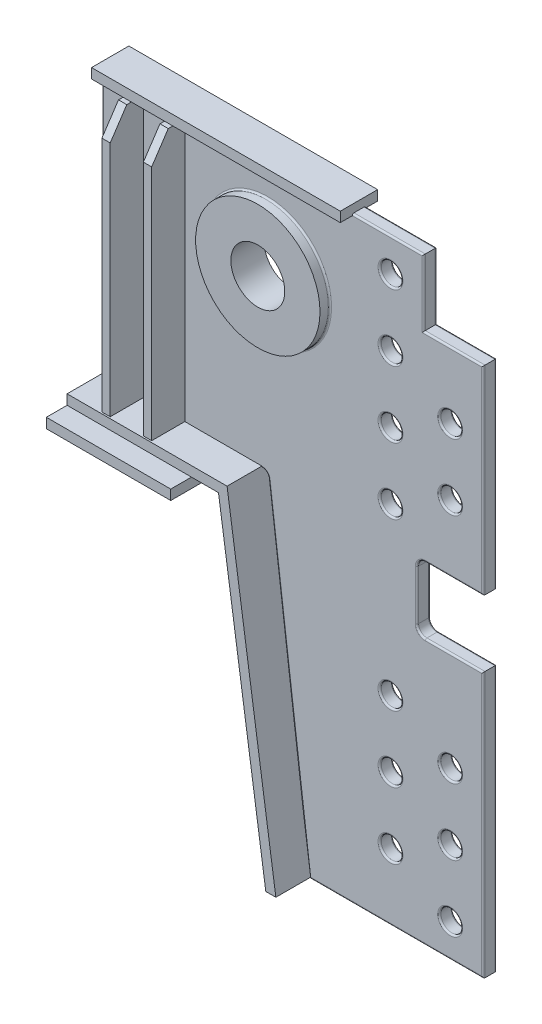
from build123d import *

# Parameters (mm, degrees)
SKETCH_1_R           = 13
SKETCH_1_R_2         = 37.5
EXTRUDE_1401_DEPTH   = 16
EXTRUDE_1_DEPTH      = 12
EXTRUDE_1_DEPTH_BACK = 28
SKETCH_2_R           = 75
SKETCH_2_R_2         = 32.5
FILLET_1_R           = 2
FILLET_2_R           = 2
EXTRUDE_2_DEPTH      = 40
EXTRUDE_2_DEPTH_BACK = 56
SKETCH_3_W           = 10
SKETCH_3_H           = 316
CUT_EXTRUDE_1_DEPTH  = 836.425640018
CUT_EXTRUDE_2_DEPTH  = 836.425640018
EXTRUDE_5_DEPTH      = 42
EXTRUDE_5_DEPTH_BACK = 58
EXTRUDE_6_DEPTH      = 14.5
EXTRUDE_6_DEPTH_BACK = 30.5
SKETCH_7_W           = 300
SKETCH_7_H           = 12
SKETCH_8_W           = 150
SKETCH_8_H           = 150
EXTRUDE_7_DEPTH      = 12


with BuildPart() as part:
    # 草图1 → Extrude 1401 (new body)
    with BuildSketch(Plane.XY):
        with BuildLine():
            Line((0, -320), (-70, -320))
            ThreePointArc((-70, -320), (-77.071067812, -322.928932188), (-80, -330))
            Line((-80, -330), (-80, -390))
            ThreePointArc((-80, -390), (-77.071067812, -397.071067812), (-70, -400))
            Line((-70, -400), (0, -400))
            Line((0, -400), (0, -720))
            Line((0, -720), (-210, -720))
            Line((-210, -720), (-259.124034735, -327.007722123))
            ThreePointArc((-259.124034735, -327.007722123), (-261.767837242, -322.002574593), (-267.062257748, -320))
            Line((-267.062257748, -320), (-460, -320))
            Line((-460, -320), (-460, 0))
            Line((-460, 0), (-72, 0))
            Line((-72, 0), (-72, -80))
            Line((-72, -80), (0, -80))
            Line((0, -80), (0, -320))
        make_face()
        with Locations((-112, -40)):
            Circle(SKETCH_1_R, mode=Mode.SUBTRACT)
        with Locations((-112, -120)):
            Circle(SKETCH_1_R, mode=Mode.SUBTRACT)
        with Locations((-112, -200)):
            Circle(SKETCH_1_R, mode=Mode.SUBTRACT)
        with Locations((-112, -280)):
            Circle(SKETCH_1_R, mode=Mode.SUBTRACT)
        with Locations((-40, -160)):
            Circle(SKETCH_1_R, mode=Mode.SUBTRACT)
        with Locations((-40, -240)):
            Circle(SKETCH_1_R, mode=Mode.SUBTRACT)
        with Locations((-40, -680)):
            Circle(SKETCH_1_R, mode=Mode.SUBTRACT)
        with Locations((-40, -600)):
            Circle(SKETCH_1_R, mode=Mode.SUBTRACT)
        with Locations((-40, -520)):
            Circle(SKETCH_1_R, mode=Mode.SUBTRACT)
        with Locations((-112, -640)):
            Circle(SKETCH_1_R, mode=Mode.SUBTRACT)
        with Locations((-112, -560)):
            Circle(SKETCH_1_R, mode=Mode.SUBTRACT)
        with Locations((-112, -480)):
            Circle(SKETCH_1_R, mode=Mode.SUBTRACT)
        with Locations((-260, -110)):
            Circle(SKETCH_1_R_2, mode=Mode.SUBTRACT)
    extrude(amount=EXTRUDE_1401_DEPTH)

    # 草图2 → 凸台-拉伸1 (add, two sides: drawn at the far end of the back side and taken through both)
    with BuildSketch(Plane.XY.offset(16).offset(-EXTRUDE_1_DEPTH_BACK)):
        with Locations((-260, -110)):
            Circle(SKETCH_2_R)
        with Locations((-260, -110)):
            Circle(SKETCH_2_R_2, mode=Mode.SUBTRACT)
    extrude(amount=EXTRUDE_1_DEPTH + EXTRUDE_1_DEPTH_BACK)

    # 圆角1
    fillet_1_edges = [part.edges().sort_by_distance(p)[0] for p in [
        (-335, -110, 16),
        (-125, -560, 16),
        (-53, -600, 16),
        (-53, -240, 16),
        (-35, -320, 16),
        (-77.071067812, -322.928932188, 16),
        (-80, -360, 16),
        (-77.071067812, -397.071067812, 16),
        (-35, -400, 16),
        (0, -560, 16),
        (-105, -720, 16),
        (-234.562017367, -523.503861062, 16),
        (-261.767837242, -322.002574593, 16),
        (-363.531128874, -320, 16),
        (-460, -160, 16),
        (-266, 0, 16),
        (-53, -680, 16),
        (-53, -520, 16),
        (-125, -480, 16),
        (-125, -640, 16),
        (-125, -280, 16),
        (-125, -120, 16),
        (-72, -40, 16),
        (-36, -80, 16),
        (0, -200, 16),
        (-125, -40, 16),
        (-125, -200, 16),
        (-53, -160, 16),
    ]]
    fillet(fillet_1_edges, radius=FILLET_1_R)

    # 圆角2
    fillet_2_edges = [part.edges().sort_by_distance(p)[0] for p in [
        (-335, -110, 0),
        (-125, -560, 0),
        (-53, -600, 0),
        (-53, -240, 0),
        (-266, 0, 0),
        (-460, -160, 0),
        (-363.531128874, -320, 0),
        (-261.767837242, -322.002574593, 0),
        (-234.562017367, -523.503861062, 0),
        (-105, -720, 0),
        (0, -560, 0),
        (-35, -400, 0),
        (-77.071067812, -397.071067812, 0),
        (-80, -360, 0),
        (-77.071067812, -322.928932188, 0),
        (-35, -320, 0),
        (-53, -680, 0),
        (-53, -520, 0),
        (-125, -480, 0),
        (-125, -640, 0),
        (-125, -280, 0),
        (-125, -120, 0),
        (0, -200, 0),
        (-36, -80, 0),
        (-72, -40, 0),
        (-125, -40, 0),
        (-125, -200, 0),
        (-53, -160, 0),
    ]]
    fillet(fillet_2_edges, radius=FILLET_2_R)

    # 草图3 → 凸台-拉伸2 (add, two sides: drawn at the far end of the back side and taken through both)
    with BuildSketch(Plane.XY.offset(16).offset(-EXTRUDE_2_DEPTH_BACK)):
        with Locations((-415, -160)):
            Rectangle(SKETCH_3_W, SKETCH_3_H)
        with Locations((-365, -160)):
            Rectangle(SKETCH_3_W, SKETCH_3_H)
    extrude(amount=EXTRUDE_2_DEPTH + EXTRUDE_2_DEPTH_BACK)

    # 草图4 → 切除-拉伸1 (cut, through all)
    with BuildSketch(Plane.ZY.offset(420)):
        Polygon((-20, -2), (-45.5, -32), (-45.5, -2), align=None)
    extrude(amount=-CUT_EXTRUDE_1_DEPTH, mode=Mode.SUBTRACT)

    # 草图5 → 切除-拉伸2 (cut, through all)
    with BuildSketch(Plane.ZY.offset(420)):
        Polygon((36, -2), (56, -32), (56, -2), align=None)
    extrude(amount=-CUT_EXTRUDE_2_DEPTH, mode=Mode.SUBTRACT)

    # 草图6 → 凸台-拉伸5 (add, two sides: drawn at the far end of the back side and taken through both)
    with BuildSketch(Plane.XY.offset(16).offset(-EXTRUDE_5_DEPTH_BACK)):
        Polygon((-267.062257748, -318), (-460, -318), (-460, -330), (-277.426505546, -330), (-220.363518026, -718), (-208.234435563, -718), align=None)
    extrude(amount=EXTRUDE_5_DEPTH + EXTRUDE_5_DEPTH_BACK)

    # 草图7 → 凸台-拉伸6 (add, two sides: drawn at the far end of the back side and taken through both)
    with BuildSketch(Plane(origin=(0, 0, 0), x_dir=(-1, 0, 0), z_dir=(0, 0, -1)).offset(-EXTRUDE_6_DEPTH_BACK)):
        with Locations((308, 4)):
            Rectangle(SKETCH_7_W, SKETCH_7_H)
    extrude(amount=EXTRUDE_6_DEPTH + EXTRUDE_6_DEPTH_BACK)

    # 草图8 → 凸台-拉伸7 (add)
    with BuildSketch(Plane.XZ.offset(330)):
        with Locations((-385, 8)):
            Rectangle(SKETCH_8_W, SKETCH_8_H)
    extrude(amount=EXTRUDE_7_DEPTH)


solid = part.part
